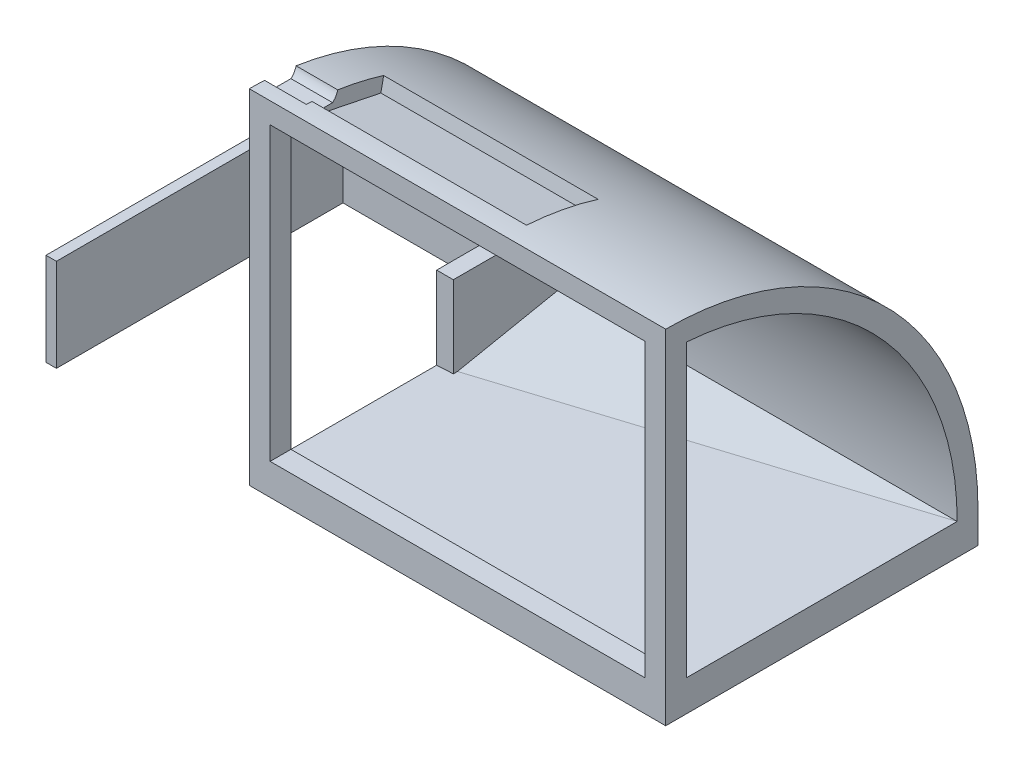
from build123d import *

# Parameters (mm, degrees)
SKETCH1_W                = 200
SKETCH1_H                = 150
BOSS_EXTRUDE1_DEPTH      = 15
SKETCH1_5_W              = 200
SKETCH1_5_H              = 10
REVOLVE1_ANGLE           = 90
BOSS_EXTRUDE3_REACH      = 197.256
BOSS_EXTRUDE3_END_RADIUS = 140
SKETCH1_6_W              = 10
SKETCH1_6_H              = 10
CUT_EXTRUDE2_DEPTH       = 103
CUT_EXTRUDE3_DEPTH       = 20
CUT_LOFT8_START          = -65
CUT_LOFT8_DEPTH          = 130
CUT_LOFT8_START_2        = -100
CUT_LOFT8_2_DEPTH        = 200
BOSS_EXTRUDE5_DEPTH      = 100
BOSS_EXTRUDE6_START      = -8
BOSS_EXTRUDE6_DEPTH      = 8
BOSS_EXTRUDE7_START      = -5
BOSS_EXTRUDE7_DEPTH      = 5


with BuildPart() as part:
    # Sketch1 → Boss-Extrude1 (new body)
    with BuildSketch(Plane(origin=(0, 0, 0), x_dir=(1, 0, 0), z_dir=(0, 1, 0))):
        Rectangle(SKETCH1_W, SKETCH1_H)
    extrude(amount=-BOSS_EXTRUDE1_DEPTH)

    # Sketch1<5> → Revolve1 (revolve)
    with BuildSketch(Plane(origin=(0, 0, 0), x_dir=(1, 0, 0), z_dir=(0, 1, 0))):
        with Locations((0, 70)):
            Rectangle(SKETCH1_5_W, SKETCH1_5_H)
    revolve(axis=Axis((-100, 0, 75), (1, 0, 0)), revolution_arc=REVOLVE1_ANGLE)

    # Boss-Extrude3: up to this cylinder (the profile starts inside it)
    boss_extrude3_end = Plane(origin=(0, 0, 75), z_dir=(-1, 0, 0)) * Cylinder(BOSS_EXTRUDE3_END_RADIUS, 865.512, mode=Mode.PRIVATE)
    # Sketch1<6> → Boss-Extrude3 (add, up to the surface)
    with BuildSketch(Plane(origin=(0, 0, 0), x_dir=(1, 0, 0), z_dir=(0, 1, 0)), mode=Mode.PRIVATE) as boss_extrude3_sk1:
        with Locations((-95, -70)):
            Rectangle(SKETCH1_6_W, SKETCH1_6_H)
    boss_extrude3_tool1 = extrude(boss_extrude3_sk1.sketch, amount=BOSS_EXTRUDE3_REACH, mode=Mode.PRIVATE) & boss_extrude3_end
    add(boss_extrude3_tool1.solids().sort_by_distance((-95, 0, 70))[0])
    # Sketch1<6> → Boss-Extrude3 (add, up to the surface)
    with BuildSketch(Plane(origin=(0, 0, 0), x_dir=(1, 0, 0), z_dir=(0, 1, 0)), mode=Mode.PRIVATE) as boss_extrude3_sk2:
        with Locations((95, -70)):
            Rectangle(SKETCH1_6_W, SKETCH1_6_H)
    boss_extrude3_tool2 = extrude(boss_extrude3_sk2.sketch, amount=BOSS_EXTRUDE3_REACH, mode=Mode.PRIVATE) & boss_extrude3_end
    add(boss_extrude3_tool2.solids().sort_by_distance((95, 0, 70))[0])

    # Sketch5 → Cut-Extrude2 (cut)
    with BuildSketch(Plane.ZY.offset(80)):
        Polygon((66.095917942, 143.620915339), (31.803061543, 136.620915339), (26.803061543, 161.115812766), (61.095917942, 168.115812766), align=None)
    extrude(amount=-CUT_EXTRUDE2_DEPTH, mode=Mode.SUBTRACT)

    # Sketch6 → Cut-Extrude3 (cut)
    with BuildSketch(Plane.ZY.offset(100)):
        with BuildLine():
            Line((55, 144.203533404), (65, 144.203533404))
            ThreePointArc((65, 144.203533404), (60, 157.655), (55, 144.203533404))
        make_face()
    extrude(amount=-CUT_EXTRUDE3_DEPTH, mode=Mode.SUBTRACT)

    # Cut-Loft8: read off the stored shape, not the designer's step
    # Cut-Loft8 outline → Cut-Loft8 (cut)
    with BuildSketch(Plane.XY.offset(CUT_LOFT8_START)):
        Polygon((-100, -10), (100, 0), (-100, 0), align=None)
    extrude(amount=CUT_LOFT8_DEPTH, mode=Mode.SUBTRACT)

    # Cut-Loft8 2 outline → Cut-Loft8 2 (add)
    with BuildSketch(Plane.YZ.offset(CUT_LOFT8_START_2)):
        Polygon((0, -65), (-10.4, -13), (-12, -13), (-12, -65), align=None)
    extrude(amount=CUT_LOFT8_2_DEPTH)

    # Sketch12 → Boss-Extrude5 (add)
    with BuildSketch(Plane.ZY.offset(100)):
        with BuildLine():
            Line((-65, -15), (-65, 0))
            ThreePointArc((-65, 0), (-64.208776017, 14.863266125), (-61.84404743, 29.558529783))
            Line((-61.84404743, 29.558529783), (-72.058809043, 29.558529783))
            ThreePointArc((-72.058809043, 29.558529783), (-74.262891163, 14.852249722), (-75, 0))
            Line((-75, 0), (-75, -15))
            Line((-75, -15), (-65, -15))
        make_face()
    extrude(amount=BOSS_EXTRUDE5_DEPTH)

    # Sketch12<4> → Boss-Extrude6 (add)
    with BuildSketch(Plane.ZY.offset(100).offset(BOSS_EXTRUDE6_START)):
        with BuildLine():
            Line((-65, 0), (-15, -10))
            Line((-15, -10), (-15, 29.558529783))
            Line((-15, 29.558529783), (-61.84404743, 29.558529783))
            ThreePointArc((-61.84404743, 29.558529783), (-64.208776017, 14.863266125), (-65, 0))
        make_face()
    extrude(amount=BOSS_EXTRUDE6_DEPTH)

    # Sketch21 → Boss-Extrude7 (add)
    with BuildSketch(Plane.ZY.offset(200).offset(BOSS_EXTRUDE7_START)):
        with BuildLine():
            Line((-61.84404743, 29.558529783), (72.644533384, 29.558529783))
            Line((72.644533384, 29.558529783), (72.644533384, -15))
            Line((72.644533384, -15), (-65, -15))
            Line((-65, -15), (-65, 0))
            ThreePointArc((-65, 0), (-64.208776017, 14.863266125), (-61.84404743, 29.558529783))
        make_face()
    extrude(amount=BOSS_EXTRUDE7_DEPTH)


solid = part.part
